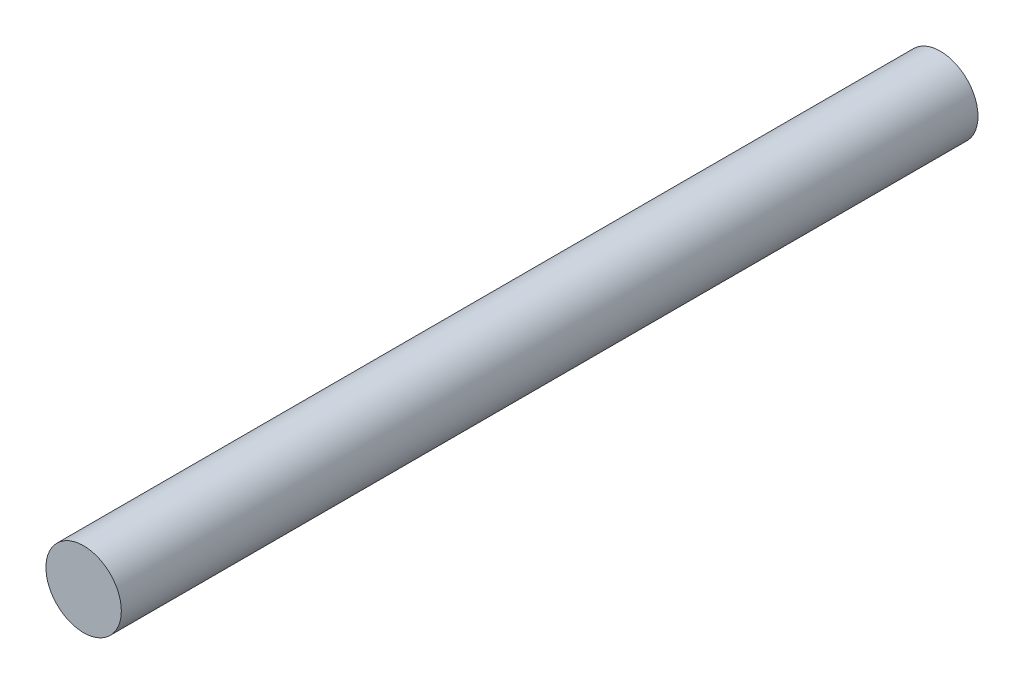
from build123d import *

# Parameters (mm, degrees)
SZKIC1_R                    = 2.2
DODANIE_WYCI_GNI_CIE1_DEPTH = 50


with BuildPart() as part:
    # Szkic1 → Dodanie-wyciągnięcie1 (new body)
    with BuildSketch(Plane.XY):
        Circle(SZKIC1_R)
    extrude(amount=DODANIE_WYCI_GNI_CIE1_DEPTH)


solid = part.part
